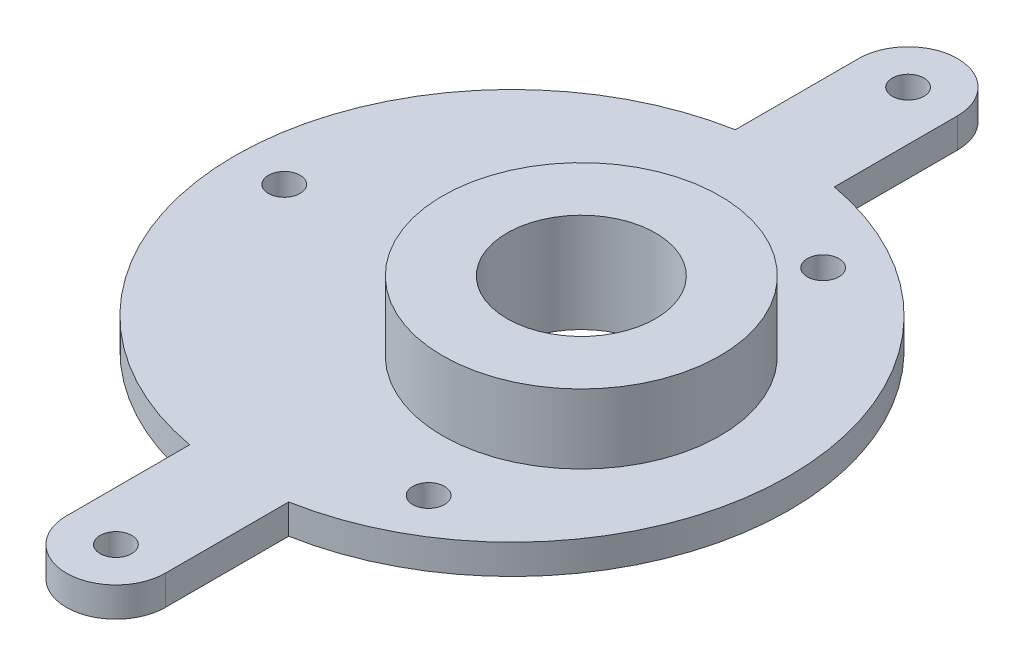
from build123d import *

# Parameters (mm, degrees)
SKETCH_1_R               = 1.6
EXTRUDE_1_DEPTH          = 3
SKETCH_4_R               = 14
EXTRUDE_2_DEPTH          = 7
CUT_EXTRUDE_1_DEPTH      = 54.460265618
CUT_EXTRUDE_1_DEPTH_BACK = 54.460265618
SKETCH_2_R               = 7.5
SKETCH_3_R               = 1.6
CUT_EXTRUDE_2_DEPTH      = 54.460265618


with BuildPart() as part:
    # ｽｹｯﾁ1 → ﾎﾞｽ - 押し出し1 (new body)
    with BuildSketch(Plane(origin=(0, 0, 0), x_dir=(1, 0, 0), z_dir=(0, 1, 0))):
        with BuildLine():
            Line((5, 40), (5, 27.549954628))
            ThreePointArc((5, 27.549954628), (28, 0), (5, -27.549954628))
            Line((5, -27.549954628), (5, -40))
            ThreePointArc((5, -40), (0, -45), (-5, -40))
            Line((-5, -40), (-5, -27.549954628))
            ThreePointArc((-5, -27.549954628), (-28, 0), (-5, 27.549954628))
            Line((-5, 27.549954628), (-5, 40))
            ThreePointArc((-5, 40), (0, 45), (5, 40))
        make_face()
        with Locations((0, 40)):
            Circle(SKETCH_1_R, mode=Mode.SUBTRACT)
        with Locations((0, -40)):
            Circle(SKETCH_1_R, mode=Mode.SUBTRACT)
    extrude(amount=EXTRUDE_1_DEPTH)

    # ｽｹｯﾁ4 → ﾎﾞｽ - 押し出し2 (add)
    with BuildSketch(Plane(origin=(0, 3, 0), x_dir=(1, 0, 0), z_dir=(0, 1, 0))):
        with Locations((7, 0)):
            Circle(SKETCH_4_R)
    extrude(amount=EXTRUDE_2_DEPTH)

    # ｽｹｯﾁ2 → ｶｯﾄ - 押し出し1 (cut, two sides: drawn at the far end of the back side and taken through both)
    with BuildSketch(Plane(origin=(0, 3, 0), x_dir=(1, 0, 0), z_dir=(0, 1, 0)).offset(-CUT_EXTRUDE_1_DEPTH_BACK)):
        with Locations((7, 0)):
            Circle(SKETCH_2_R)
    extrude(amount=CUT_EXTRUDE_1_DEPTH + CUT_EXTRUDE_1_DEPTH_BACK, mode=Mode.SUBTRACT)

    # ｽｹｯﾁ3 → ｶｯﾄ - 押し出し2 (cut, through all)
    with BuildSketch(Plane(origin=(0, 3, 0), x_dir=(1, 0, 0), z_dir=(0, 1, 0))):
        with Locations((-23, 0)):
            Circle(SKETCH_3_R)
        with Locations((11.5, 19.918584287)):
            Circle(SKETCH_3_R)
        with Locations((11.5, -19.918584287)):
            Circle(SKETCH_3_R)
    extrude(amount=-CUT_EXTRUDE_2_DEPTH, mode=Mode.SUBTRACT)


solid = part.part
